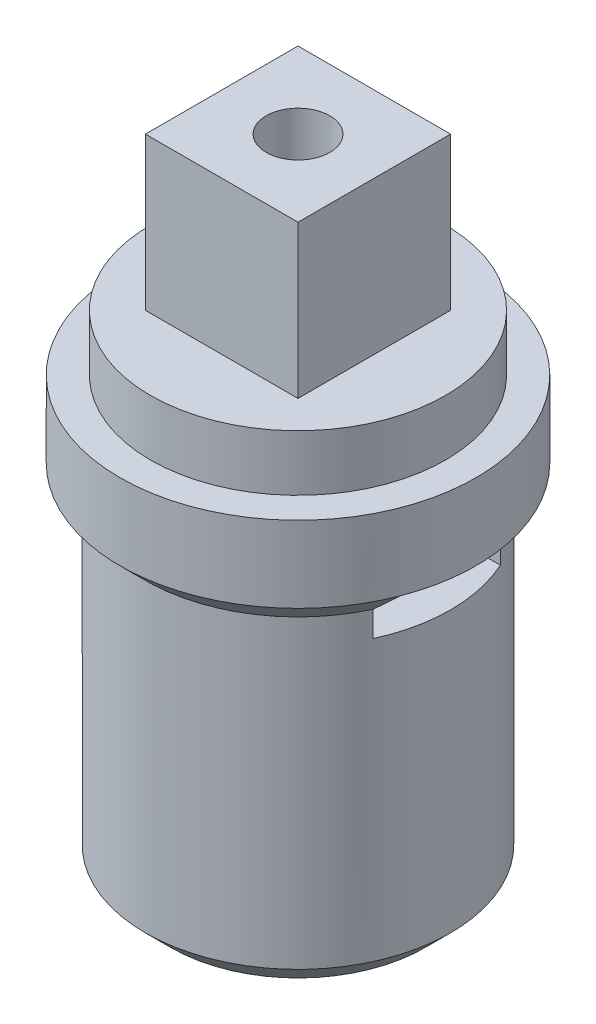
from build123d import *
from build123d.topology import SkipClean

# Parameters (mm, degrees)
SKETCH_1_R          = 6
EXTRUDE_1_DEPTH     = 9
CUT_EXTRUDE_1_DEPTH = 13.369316877
SKETCH_3_R          = 6
EXTRUDE_2_DEPTH     = 3
SKETCH_4_R          = 1.5
CUT_EXTRUDE_2_DEPTH = 3
EXTRUDE_3_DEPTH     = 2
SKETCH_7_R          = 7
EXTRUDE_4_DEPTH     = 3
SKETCH_8_R          = 5.8
EXTRUDE_5_DEPTH     = 2.2
SKETCH_9_R          = 1.3
CUT_EXTRUDE_3_DEPTH = 6
CHAMFER_1_SIZE      = 1
SKETCH_10_W         = 6
SKETCH_10_H         = 6
EXTRUDE_6_DEPTH     = 6
SKETCH_11_R         = 1.25
CUT_EXTRUDE_4_DEPTH = 8


with BuildPart() as part:
    # Эскиз1 → Бобышка-Вытянуть1 (new body)
    with BuildSketch(Plane(origin=(0, 0, 0), x_dir=(1, 0, 0), z_dir=(0, 1, 0))):
        with Locations(Location((0, 0, 0), (0, 0, 270))):
            Circle(SKETCH_1_R)
    extrude(amount=EXTRUDE_1_DEPTH)

    # Эскиз2 → Вырез-Вытянуть1 (cut, through all)
    with BuildSketch(Plane(origin=(0, 9, 0), x_dir=(1, 0, 0), z_dir=(0, 1, 0))):
        with BuildLine():
            Line((-1.28, 1.404136745), (-1.28, -1.404136745))
            ThreePointArc((-1.28, -1.404136745), (1.9, 0), (-1.28, 1.404136745))
        make_face()
    extrude(amount=-CUT_EXTRUDE_1_DEPTH, mode=Mode.SUBTRACT)

    # Эскиз3 → Бобышка-Вытянуть2 (add)
    with BuildSketch(Plane(origin=(0, 9, 0), x_dir=(1, 0, 0), z_dir=(0, 1, 0))):
        with Locations(Location((0, 0, 0), (0, 0, 270))):
            Circle(SKETCH_3_R)
    extrude(amount=EXTRUDE_2_DEPTH)

    # Эскиз4 → Вырез-Вытянуть2 (cut)
    with BuildSketch(Plane(origin=(0, 12, 0), x_dir=(1, 0, 0), z_dir=(0, 1, 0))):
        with Locations(Location((0, 0, 0), (0, 0, 270))):
            Circle(SKETCH_4_R)
    extrude(amount=-CUT_EXTRUDE_2_DEPTH, mode=Mode.SUBTRACT)

    # Эскиз5 → Бобышка-Вытянуть3 (add)
    with SkipClean():  # the faces are left unmerged after this step: merging them gives an invalid solid
        with BuildSketch(Plane(origin=(0, 12, 0), x_dir=(1, 0, 0), z_dir=(0, 1, 0))):
            with BuildLine():
                Line((5.454356057, 2.5), (-5.454356057, 2.5))
                ThreePointArc((-5.454356057, 2.5), (0, 6), (5.454356057, 2.5))
            make_face()
            with BuildLine():
                Line((5.454356057, -2.5), (-5.454356057, -2.5))
                ThreePointArc((-5.454356057, -2.5), (0, -6), (5.454356057, -2.5))
            make_face()
        extrude(amount=EXTRUDE_3_DEPTH)

    # Эскиз7 → Бобышка-Вытянуть4 (add)
    with BuildSketch(Plane(origin=(0, 14, 0), x_dir=(1, 0, 0), z_dir=(0, 1, 0))):
        with Locations(Location((0, 0, 0), (0, 0, 270))):
            Circle(SKETCH_7_R)
    extrude(amount=EXTRUDE_4_DEPTH)

    # Эскиз8 → Бобышка-Вытянуть5 (add)
    with BuildSketch(Plane(origin=(0, 17, 0), x_dir=(1, 0, 0), z_dir=(0, 1, 0))):
        with Locations(Location((0, 0, 0), (0, 0, 270))):
            Circle(SKETCH_8_R)
    extrude(amount=EXTRUDE_5_DEPTH)

    # Эскиз9 → Вырез-Вытянуть3 (cut)
    with BuildSketch(Plane(origin=(0, 19.2, 0), x_dir=(1, 0, 0), z_dir=(0, 1, 0))):
        with Locations(Location((0, 0, 0), (0, 0, 270))):
            Circle(SKETCH_9_R)
    extrude(amount=-CUT_EXTRUDE_3_DEPTH, mode=Mode.SUBTRACT)

    # Фаска1
    # the kernel refuses this chamfer: 1 mm, written as the material it adds along each edge
    with BuildSketch(Plane(origin=(0, 14, 0), x_dir=(-0.9999996815285755, 0, -0.0007980869299166744), z_dir=(-0.0007980869299166744, 0, 0.9999996815285755))) as chamfer_1_piece_1_section:
        Polygon((6 + CHAMFER_1_SIZE, 0), (6, CHAMFER_1_SIZE), (6, 0), align=None)
    chamfer_1_piece_1 = revolve(axis=Axis((0, 14, 0), (0, -1, 0)), revolution_arc=179.908545965, mode=Mode.PRIVATE)
    chamfer_1_piece_1 = chamfer_1_piece_1 & Plane(origin=(0, 13.500057011, 0), x_dir=(0, 0, 1), z_dir=(0, -1, 0)) * Cylinder(7, 28, mode=Mode.PRIVATE)
    chamfer_1_piece_1 = split(chamfer_1_piece_1, bisect_by=Plane(origin=(0, 13.500057011, -2.5), z_dir=(0, 0, -1)), keep=Keep.TOP, mode=Mode.PRIVATE)
    add(chamfer_1_piece_1)
    with BuildSketch(Plane(origin=(0, 14, 0), x_dir=(-0.9999996815285755, 0, 0.0007980869299168965), z_dir=(-0.0007980869299168965, 0, -0.9999996815285755))) as chamfer_1_piece_2_section:
        Polygon((6 + CHAMFER_1_SIZE, 0), (6, -CHAMFER_1_SIZE), (6, 0), align=None)
    chamfer_1_piece_2 = revolve(axis=Axis((0, 14, 0), (0, 1, 0)), revolution_arc=179.908545965, mode=Mode.PRIVATE)
    chamfer_1_piece_2 = chamfer_1_piece_2 & Plane(origin=(0, 13.500057011, 0), x_dir=(0, 0, 1), z_dir=(0, -1, 0)) * Cylinder(7, 28, mode=Mode.PRIVATE)
    chamfer_1_piece_2 = split(chamfer_1_piece_2, bisect_by=Plane(origin=(0, 13.500057011, 2.5), z_dir=(0, 0, 1)), keep=Keep.TOP, mode=Mode.PRIVATE)
    add(chamfer_1_piece_2)
    # the kernel refuses this chamfer: 1 mm, written as the material it takes off along each edge
    with BuildSketch(Plane(origin=(0, 0, 0), x_dir=(0, 0, 1), z_dir=(-1, 0, 0))) as chamfer_1_2_piece_1:
        Polygon((6 - CHAMFER_1_SIZE, 0), (6, CHAMFER_1_SIZE), (6, 0), align=None)
    revolve(axis=Axis((0, 0, 0), (0, 1, 0)), mode=Mode.SUBTRACT)

    # Эскиз10 → Бобышка-Вытянуть6 (add)
    with BuildSketch(Plane(origin=(0, 19.2, 0), x_dir=(1, 0, 0), z_dir=(0, 1, 0))):
        Rectangle(SKETCH_10_W, SKETCH_10_H)
    extrude(amount=EXTRUDE_6_DEPTH)

    # Эскиз11 → Вырез-Вытянуть4 (cut)
    with BuildSketch(Plane(origin=(0, 25.2, 0), x_dir=(1, 0, 0), z_dir=(0, 1, 0))):
        with Locations(Location((0, 0, 0), (0, 0, 270))):
            Circle(SKETCH_11_R)
    extrude(amount=-CUT_EXTRUDE_4_DEPTH, mode=Mode.SUBTRACT)


solid = part.part
